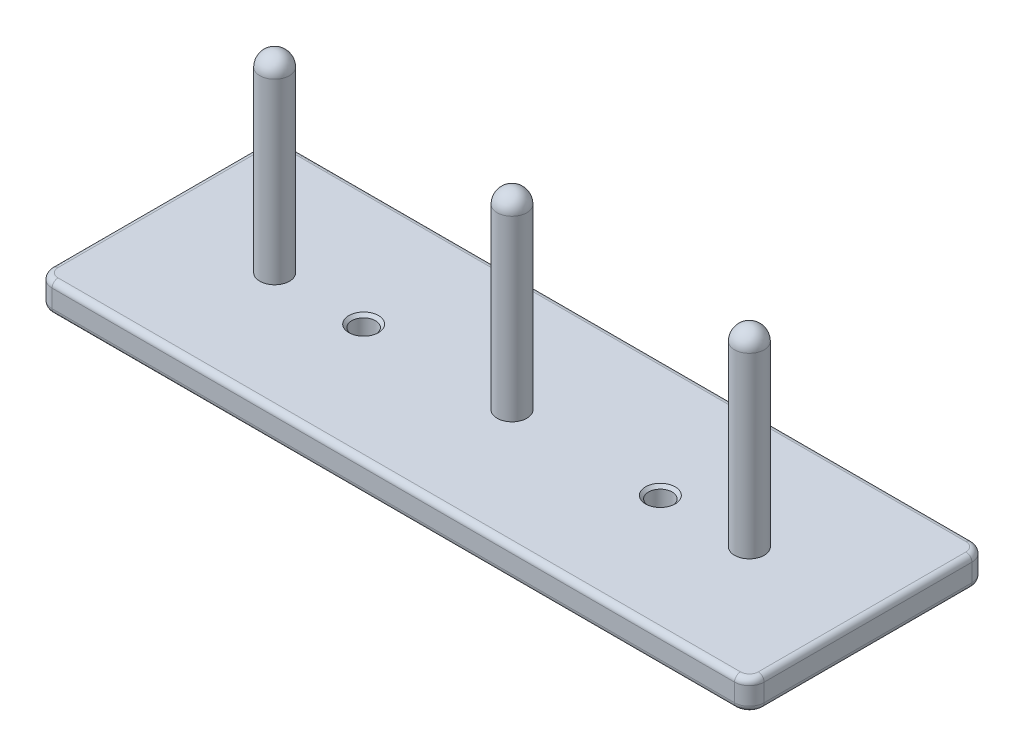
from build123d import *

# Parameters (mm, degrees)
SKETCH_4_W          = 240
SKETCH_4_H          = 80
EXTRUDE_2_DEPTH     = 10
CUT_EXTRUDE_START   = 2
SKETCH_5_W          = 236
SKETCH_5_H          = 76
CUT_EXTRUDE_1_DEPTH = 6
FILLET_2_R          = 5
FILLET_1_R          = 2
SKETCH_6_R          = 5
SKETCH_6_R_2        = 3.5
EXTRUDE_3_DEPTH     = 70
CUT_EXTRUDE_2_REACH = 148.068
CUT_EXTRUDE_START_2 = 1.5
SKETCH_7_R          = 4
SKETCH_8_R          = 5.5
SKETCH_8_R_2        = 4
EXTRUDE_4_DEPTH     = 10
SKETCH_9_R          = 2
CUT_EXTRUDE_3_DEPTH = 10
CHAMFER_1_SIZE      = 1


# Read off the part's stored shape, not the designer's step: 旋转2
with BuildPart() as part:
    # 草图4 → 凸台-拉伸2 (new body)
    with BuildSketch(Plane(origin=(0, 0, 0), x_dir=(1, 0, 0), z_dir=(0, 1, 0))):
        Rectangle(SKETCH_4_W, SKETCH_4_H)
    extrude(amount=EXTRUDE_2_DEPTH)

    # 草图5 → 切除-拉伸1 (cut)
    with BuildSketch(Plane(origin=(0, 0, 0), x_dir=(1, 0, 0), z_dir=(0, 1, 0)).offset(CUT_EXTRUDE_START)):
        Rectangle(SKETCH_5_W, SKETCH_5_H)
    extrude(amount=CUT_EXTRUDE_1_DEPTH, mode=Mode.SUBTRACT)

    # 圆角2
    fillet_2_edges = [part.edges().sort_by_distance(p)[0] for p in [
        (120, 5, 40),
        (-120, 5, 40),
        (-120, 5, -40),
        (120, 5, -40),
    ]]
    fillet(fillet_2_edges, radius=FILLET_2_R)

    # 圆角1
    fillet_1_edges = [part.edges().sort_by_distance(p)[0] for p in [
        (120, 0, 0),
        (120, 10, 0),
        (0, 0, 40),
        (-120, 0, 0),
        (0, 0, -40),
        (118.535533906, 0, -38.535533906),
        (-118.535533906, 0, -38.535533906),
        (-118.535533906, 0, 38.535533906),
        (118.535533906, 0, 38.535533906),
        (0, 10, 40),
        (0, 10, -40),
        (-120, 10, 0),
        (118.535533906, 10, -38.535533906),
        (-118.535533906, 10, -38.535533906),
        (-118.535533906, 10, 38.535533906),
        (118.535533906, 10, 38.535533906),
    ]]
    fillet(fillet_1_edges, radius=FILLET_1_R)

    # 草图6 → 凸台-拉伸3 (add)
    # profile 1 of 3: a face of its own
    with BuildSketch(Plane(origin=(0, 0, 0), x_dir=(1, 0, 0), z_dir=(0, 1, 0))):
        with Locations(Location((-80, 0, 0), (0, 0, 90))):
            Circle(SKETCH_6_R)
        with Locations(Location((-80, 0, 0), (0, 0, 90))):
            Circle(SKETCH_6_R_2, mode=Mode.SUBTRACT)
    # profile 2 of 3: a face of its own
    with BuildSketch(Plane(origin=(0, 0, 0), x_dir=(1, 0, 0), z_dir=(0, 1, 0))):
        with Locations(Location((0, 0, 0), (0, 0, 90))):
            Circle(SKETCH_6_R)
        with Locations(Location((0, 0, 0), (0, 0, 90))):
            Circle(SKETCH_6_R_2, mode=Mode.SUBTRACT)
    # profile 3 of 3: a face of its own
    with BuildSketch(Plane(origin=(0, 0, 0), x_dir=(1, 0, 0), z_dir=(0, 1, 0))):
        with Locations(Location((80, 0, 0), (0, 0, 90))):
            Circle(SKETCH_6_R)
        with Locations(Location((80, 0, 0), (0, 0, 90))):
            Circle(SKETCH_6_R_2, mode=Mode.SUBTRACT)
    extrude(amount=EXTRUDE_3_DEPTH)

    # 切除-拉伸2: up to this face of the body (flat: up to its plane)
    cut_extrude_2_end = Plane(part.part.faces().sort_by_distance((115.520645245, 10, 0))[0])
    # 草图7 → 切除-拉伸2 (cut, up to the picked face)
    with BuildSketch(Plane(origin=(0, 0, 0), x_dir=(1, 0, 0), z_dir=(0, 1, 0)).offset(CUT_EXTRUDE_START_2), mode=Mode.PRIVATE) as cut_extrude_2_sk1:
        with Locations(Location((-50, 0, 0), (0, 0, 90))):
            Circle(SKETCH_7_R)
    cut_extrude_2_tool1 = split(extrude(cut_extrude_2_sk1.sketch, amount=CUT_EXTRUDE_2_REACH, mode=Mode.PRIVATE), bisect_by=cut_extrude_2_end, keep=Keep.BOTH, mode=Mode.PRIVATE)
    # 草图7 → 切除-拉伸2 (cut, up to the picked face)
    with BuildSketch(Plane(origin=(0, 0, 0), x_dir=(1, 0, 0), z_dir=(0, 1, 0)).offset(CUT_EXTRUDE_START_2), mode=Mode.PRIVATE) as cut_extrude_2_sk2:
        with Locations(Location((50, 0, 0), (0, 0, 90))):
            Circle(SKETCH_7_R)
    cut_extrude_2_tool2 = split(extrude(cut_extrude_2_sk2.sketch, amount=CUT_EXTRUDE_2_REACH, mode=Mode.PRIVATE), bisect_by=cut_extrude_2_end, keep=Keep.BOTH, mode=Mode.PRIVATE)
    add(cut_extrude_2_tool1.solids().sort_by(Axis((-50, 1.5, 0), (0, 1, 0)))[0], mode=Mode.SUBTRACT)
    add(cut_extrude_2_tool2.solids().sort_by(Axis((50, 1.5, 0), (0, 1, 0)))[0], mode=Mode.SUBTRACT)

    # 草图8 → 凸台-拉伸4 (add)
    # profile 1 of 2: a face of its own
    with BuildSketch(Plane(origin=(0, 0, 0), x_dir=(1, 0, 0), z_dir=(0, 1, 0))):
        with Locations(Location((-50, 0, 0), (0, 0, 90))):
            Circle(SKETCH_8_R)
        with Locations(Location((-50, 0, 0), (0, 0, 90))):
            Circle(SKETCH_8_R_2, mode=Mode.SUBTRACT)
    # profile 2 of 2: a face of its own
    with BuildSketch(Plane(origin=(0, 0, 0), x_dir=(1, 0, 0), z_dir=(0, 1, 0))):
        with Locations(Location((50, 0, 0), (0, 0, 90))):
            Circle(SKETCH_8_R)
        with Locations(Location((50, 0, 0), (0, 0, 90))):
            Circle(SKETCH_8_R_2, mode=Mode.SUBTRACT)
    extrude(amount=EXTRUDE_4_DEPTH)

    # 草图9 → 切除-拉伸3 (cut)
    with BuildSketch(Plane(origin=(0, 0, 0), x_dir=(1, 0, 0), z_dir=(0, 1, 0))):
        with Locations(Location((-50, 0, 0), (0, 0, 90))):
            Circle(SKETCH_9_R)
        with Locations(Location((50, 0, 0), (0, 0, 90))):
            Circle(SKETCH_9_R)
    extrude(amount=CUT_EXTRUDE_3_DEPTH, mode=Mode.SUBTRACT)

    # 倒角1
    chamfer_1_edges = [part.edges().sort_by_distance(p)[0] for p in [
        (-50, 10, 4),
        (50, 10, 4),
    ]]
    chamfer(chamfer_1_edges, length=CHAMFER_1_SIZE)

    # 旋转2 outline → 旋转2 (revolve)
    with BuildSketch(Plane(origin=(-80, 0, 0), x_dir=(1, 0, 0), z_dir=(0, 0, 1))):
        with BuildLine():
            Line((3.5, 69.999999996), (5, 69.999999996))
            ThreePointArc((5, 69.999999996), (3.535533907, 73.535533905), (0, 75))
            Line((0, 75), (0, 73.5))
            ThreePointArc((0, 73.5), (2.474873735, 72.474873733), (3.5, 69.999999996))
        make_face()
    revolve(axis=Axis((-80, 0, 0), (0, 1, 0)))

    # 草图13 → 旋转3 (revolve)
    with BuildSketch(Plane.XY):
        with BuildLine():
            Line((83.5, 70), (85, 70))
            ThreePointArc((85, 70), (83.535533906, 73.535533906), (80, 75))
            Line((80, 75), (80, 73.5))
            ThreePointArc((80, 73.5), (82.474873734, 72.474873734), (83.5, 70))
        make_face()
    revolve(axis=Axis((80, -930, 0), (0, 1, 0)))

    # 草图14 → 旋转5 (revolve)
    with BuildSketch(Plane.XY):
        with BuildLine():
            Line((0, 75), (0, 73.5))
            ThreePointArc((0, 73.5), (2.474873734, 72.474873734), (3.5, 70))
            Line((3.5, 70), (5, 70))
            ThreePointArc((5, 70), (3.535533906, 73.535533906), (0, 75))
        make_face()
    revolve(axis=Axis((0, -1000, 0), (0, 1, 0)))


solid = part.part
